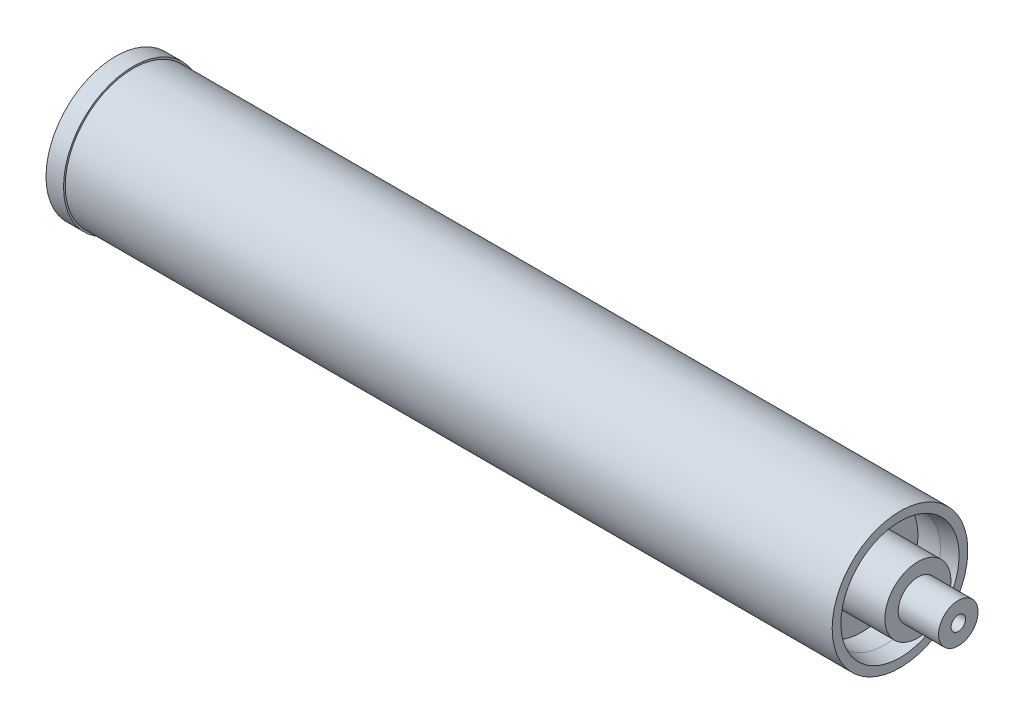
from build123d import *

# Parameters (mm, degrees)
ESQUISSE3_W = 22.321938507
ESQUISSE3_H = 5.236746853


with BuildPart() as part:
    # Esquisse2 → Révolution7 (revolve)
    with BuildSketch(Plane.XY):
        Polygon((0, 26), (12.7, 26), (36.56741584, 26), (36.56741584, 35.689138439), (25.4, 35.689138439), (12.7, 38.2095), (12.7, 50.419), (25.4, 50.419), (25.4, 49.149), (581.02, 49.149), (581.02, 42.820187711), (569.69714835, 40.573126289), (553.411969834, 40.573126289), (553.411969834, 23.9395), (593.98, 23.9395), (593.98, 14.2875), (623.27, 14.2875), (623.27, 0), (0, 0), align=None)
    revolve(axis=Axis((0, 0, 0), (1, 0, 0)))

    # Esquisse3 → Enlèvement de matière-Révolution1 (revolve, cut)
    with BuildSketch(Plane.XY):
        Polygon((0, 20), (0, 0), (549.064746608, 0), (588.42601777, 0), (588.42601777, 15.283502863), (549.064746608, 15.283502863), (549.064746608, 44.271024873), (65.871878934, 44.271024873), (34.08300614, 14.327580407), (19.08300614, 14.327580407), align=None)
        with Locations((612.109030747, 2.618373427)):
            Rectangle(ESQUISSE3_W, ESQUISSE3_H)
    revolve(axis=Axis((0, 0, 0), (1, 0, 0)), mode=Mode.SUBTRACT)


solid = part.part
